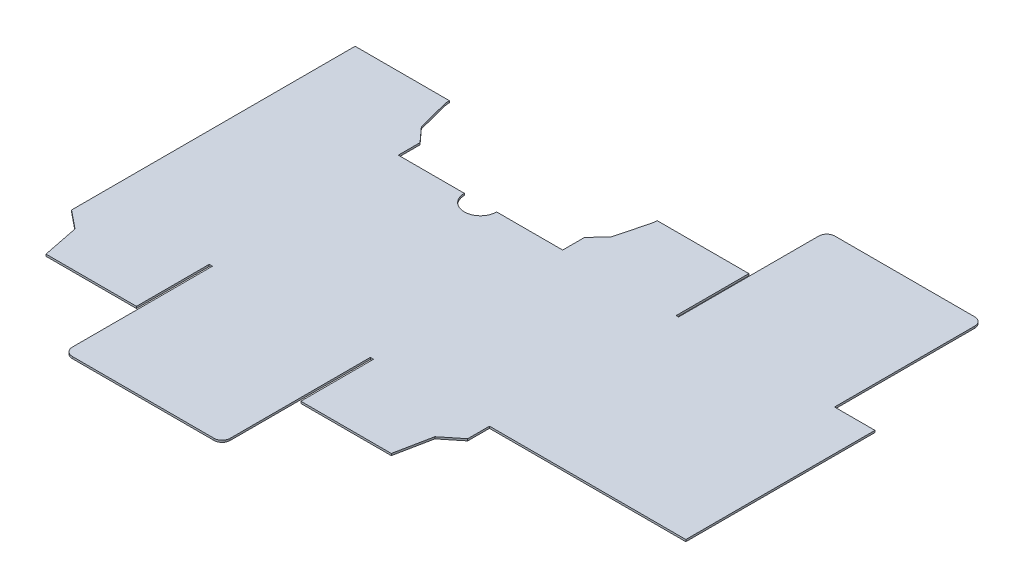
from build123d import *

# Parameters (mm, degrees)
BOSS_EXTRUDE1_DEPTH = 1.2


with BuildPart() as part:
    # Sketch1 → Boss-Extrude1 (new body)
    with BuildSketch(Plane(origin=(0, 0, 0), x_dir=(1, 0, 0), z_dir=(0, 1, 0))):
        with BuildLine():
            Line((-52.420457213, 58.5), (-52.420457213, 71.946194901))
            Line((-52.420457213, 71.946194901), (-60.488236819, 80.830210159))
            Line((-60.488236819, 80.830210159), (-65.373616564, 99.749725089))
            ThreePointArc((-65.373616564, 99.749725089), (-65.730427555, 101.60979478), (-65.85, 103.5))
            Line((-65.85, 103.5), (-124.130457213, 103.5))
            Line((-124.130457213, 103.5), (-124.130457213, -71.95))
            Line((-124.130457213, -71.95), (-112.891350531, -81.0301662))
            Line((-112.891350531, -81.0301662), (-108.397048281, -103.5))
            Line((-108.397048281, -103.5), (-52.420457213, -103.5))
            Line((-52.420457213, -103.5), (-52.420457213, -58.5))
            Line((-52.420457213, -58.5), (-50.420457213, -58.5))
            Line((-50.420457213, -58.5), (-50.420457213, -145.21))
            ThreePointArc((-50.420457213, -145.21), (-48.955991119, -148.745533906), (-45.420457213, -150.21))
            Line((-45.420457213, -150.21), (42.279542787, -150.21))
            ThreePointArc((42.279542787, -150.21), (45.815076693, -148.745533906), (47.279542787, -145.21))
            Line((47.279542787, -145.21), (47.279542787, -58.5))
            Line((47.279542787, -58.5), (49.279542787, -58.5))
            Line((49.279542787, -58.5), (49.279542787, -103.5))
            Line((49.279542787, -103.5), (105.256133855, -103.5))
            Line((105.256133855, -103.5), (109.750436105, -81.0301662))
            Line((109.750436105, -81.0301662), (120.989542787, -71.95))
            Line((120.989542787, -71.95), (120.989542787, -58.5))
            Line((120.989542787, -58.5), (242.489542787, -58.5))
            Line((242.489542787, -58.5), (242.489542787, 58.5))
            Line((242.489542787, 58.5), (217.489542787, 58.5))
            Line((217.489542787, 58.5), (217.489542787, 145.21))
            ThreePointArc((217.489542787, 145.21), (216.025076693, 148.745533906), (212.489542787, 150.21))
            Line((212.489542787, 150.21), (125.989542787, 150.21))
            ThreePointArc((125.989542787, 150.21), (122.454008881, 148.745533906), (120.989542787, 145.21))
            Line((120.989542787, 145.21), (120.989542787, 58.5))
            Line((120.989542787, 58.5), (119.489542787, 58.5))
            Line((119.489542787, 58.5), (119.489542787, 103.5))
            Line((119.489542787, 103.5), (62.709085574, 103.5))
            ThreePointArc((62.709085574, 103.5), (62.589513129, 101.60979478), (62.232702138, 99.749725089))
            Line((62.232702138, 99.749725089), (57.347322393, 80.830210159))
            Line((57.347322393, 80.830210159), (49.279542787, 71.946194901))
            Line((49.279542787, 71.946194901), (49.279542787, 58.5))
            Line((49.279542787, 58.5), (8.429542787, 58.5))
            ThreePointArc((8.429542787, 58.5), (-1.570457213, 48.5), (-11.570457213, 58.5))
            Line((-11.570457213, 58.5), (-52.420457213, 58.5))
        make_face()
    extrude(amount=BOSS_EXTRUDE1_DEPTH)


solid = part.part
